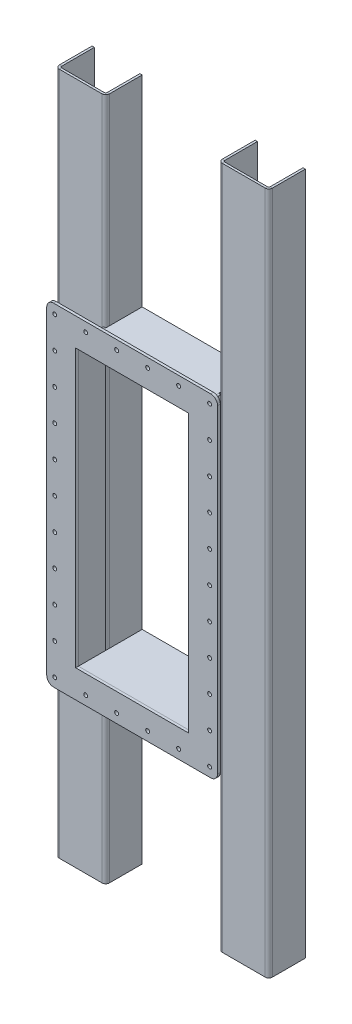
from build123d import *

# Parameters (mm, degrees)
SKETCH1_R             = 4.25
SKETCH1_W             = 248
SKETCH1_H             = 608
BOSS_EXTRUDE1_DEPTH   = 6
SKETCH2_W             = 60
SKETCH2_H             = 608
BOSS_EXTRUDE2_DEPTH   = 5
MOVE_FACE1_BY         = 5
MOVE_FACE1_2_BY       = 5
SKETCH3_W             = 248
SKETCH3_H             = 5
BOSS_EXTRUDE3_DEPTH   = 140
BOSS_EXTRUDE3_2_DEPTH = 140
BASE_FLANGE1_DEPTH    = 750


# Sheet-metal steps are written as plain solids
with BuildPart() as part:
    # Sketch1 → Boss-Extrude1 (new body)
    with BuildSketch(Plane.XY):
        with BuildLine():
            Line((-187.5, 350), (-187.5, -350))
            ThreePointArc((-187.5, -350), (-183.106601718, -360.606601718), (-172.5, -365))
            Line((-172.5, -365), (172.5, -365))
            ThreePointArc((172.5, -365), (183.106601718, -360.606601718), (187.5, -350))
            Line((187.5, -350), (187.5, 350))
            ThreePointArc((187.5, 350), (183.106601718, 360.606601718), (172.5, 365))
            Line((172.5, 365), (-172.5, 365))
            ThreePointArc((-172.5, 365), (-183.106601718, 360.606601718), (-187.5, 350))
        make_face()
        with Locations((170, 345)):
            Circle(SKETCH1_R, mode=Mode.SUBTRACT)
        with Locations((102, 345)):
            Circle(SKETCH1_R, mode=Mode.SUBTRACT)
        with Locations((34, 345)):
            Circle(SKETCH1_R, mode=Mode.SUBTRACT)
        with Locations((-34, 345)):
            Circle(SKETCH1_R, mode=Mode.SUBTRACT)
        with Locations((-102, 345)):
            Circle(SKETCH1_R, mode=Mode.SUBTRACT)
        with Locations((-170, 345)):
            Circle(SKETCH1_R, mode=Mode.SUBTRACT)
        with Locations((170, 276)):
            Circle(SKETCH1_R, mode=Mode.SUBTRACT)
        with Locations((170, 207)):
            Circle(SKETCH1_R, mode=Mode.SUBTRACT)
        with Locations((170, 138)):
            Circle(SKETCH1_R, mode=Mode.SUBTRACT)
        with Locations((170, 69)):
            Circle(SKETCH1_R, mode=Mode.SUBTRACT)
        with Locations((170, 0)):
            Circle(SKETCH1_R, mode=Mode.SUBTRACT)
        with Locations((170, -69)):
            Circle(SKETCH1_R, mode=Mode.SUBTRACT)
        with Locations((170, -138)):
            Circle(SKETCH1_R, mode=Mode.SUBTRACT)
        with Locations((170, -207)):
            Circle(SKETCH1_R, mode=Mode.SUBTRACT)
        with Locations((170, -276)):
            Circle(SKETCH1_R, mode=Mode.SUBTRACT)
        with Locations((170, -345)):
            Circle(SKETCH1_R, mode=Mode.SUBTRACT)
        with Locations((102, -345)):
            Circle(SKETCH1_R, mode=Mode.SUBTRACT)
        with Locations((34, -345)):
            Circle(SKETCH1_R, mode=Mode.SUBTRACT)
        with Locations((-34, -345)):
            Circle(SKETCH1_R, mode=Mode.SUBTRACT)
        with Locations((-102, -345)):
            Circle(SKETCH1_R, mode=Mode.SUBTRACT)
        with Locations((-170, -345)):
            Circle(SKETCH1_R, mode=Mode.SUBTRACT)
        with Locations((-170, -276)):
            Circle(SKETCH1_R, mode=Mode.SUBTRACT)
        with Locations((-170, -207)):
            Circle(SKETCH1_R, mode=Mode.SUBTRACT)
        with Locations((-170, -138)):
            Circle(SKETCH1_R, mode=Mode.SUBTRACT)
        with Locations((-170, -69)):
            Circle(SKETCH1_R, mode=Mode.SUBTRACT)
        with Locations((-170, 0)):
            Circle(SKETCH1_R, mode=Mode.SUBTRACT)
        with Locations((-170, 69)):
            Circle(SKETCH1_R, mode=Mode.SUBTRACT)
        with Locations((-170, 138)):
            Circle(SKETCH1_R, mode=Mode.SUBTRACT)
        with Locations((-170, 207)):
            Circle(SKETCH1_R, mode=Mode.SUBTRACT)
        with Locations((-170, 276)):
            Circle(SKETCH1_R, mode=Mode.SUBTRACT)
        Rectangle(SKETCH1_W, SKETCH1_H, mode=Mode.SUBTRACT)
    extrude(amount=-BOSS_EXTRUDE1_DEPTH)


with BuildPart() as body_2:
    # Sketch2 → Boss-Extrude2 (new body)
    with BuildSketch(Plane(origin=(-124, 0, 0), x_dir=(0, 0, -1), z_dir=(1, 0, 0))):
        with Locations((36, 0)):
            Rectangle(SKETCH2_W, SKETCH2_H)
    extrude(amount=-BOSS_EXTRUDE2_DEPTH)

    # Move Face1: a face moved outward by 5.0
    extrude(body_2.faces().sort_by_distance((-126.5, 304, -36))[0], amount=MOVE_FACE1_BY, dir=(0, 1, 0))

    # Move Face1 2: a face moved outward by 5.0
    extrude(body_2.faces().sort_by_distance((-126.5, -304, -36))[0], amount=MOVE_FACE1_2_BY, dir=(0, -1, 0))


with BuildPart() as body_3:
    # Mirror1: mirrored copy
    add(body_2.part.mirror(Plane(origin=(0, 0, 0), x_dir=(0, 0, 1), z_dir=(1, 0, 0))))


with BuildPart() as body_4:
    # Sketch3 → Boss-Extrude3 (new body)
    with BuildSketch(Plane(origin=(0, 0, -6), x_dir=(-1, 0, 0), z_dir=(0, 0, -1))):
        with Locations((0, 306.5)):
            Rectangle(SKETCH3_W, SKETCH3_H)
    extrude(amount=BOSS_EXTRUDE3_DEPTH)


with BuildPart() as body_5:
    # Sketch3 → Boss-Extrude3 2 (new body)
    with BuildSketch(Plane(origin=(0, 0, -6), x_dir=(-1, 0, 0), z_dir=(0, 0, -1))):
        with Locations((0, -306.5)):
            Rectangle(SKETCH3_W, SKETCH3_H)
    extrude(amount=BOSS_EXTRUDE3_2_DEPTH)


with BuildPart() as body_6:
    # Sketch8 → Base-Flange1 (new, symmetric)
    with BuildSketch(Plane(origin=(0, 0, 0), x_dir=(1, 0, 0), z_dir=(0, 1, 0))):
        with BuildLine():
            Line((124, 146), (124, 74))
            ThreePointArc((124, 74), (126.343145751, 68.343145751), (132, 66))
            Line((132, 66), (226, 66))
            ThreePointArc((226, 66), (231.656854249, 68.343145751), (234, 74))
            Line((234, 74), (234, 146))
            Line((234, 146), (229, 146))
            Line((229, 146), (229, 74))
            ThreePointArc((229, 74), (228.121320344, 71.878679656), (226, 71))
            Line((226, 71), (132, 71))
            ThreePointArc((132, 71), (129.878679656, 71.878679656), (129, 74))
            Line((129, 74), (129, 146))
            Line((129, 146), (124, 146))
        make_face()
    extrude(amount=BASE_FLANGE1_DEPTH, both=True)


with BuildPart() as body_7:
    # Mirror2: mirrored copy
    add(body_6.part.mirror(Plane(origin=(0, 0, 0), x_dir=(0, 0, 1), z_dir=(1, 0, 0))))


solid = Compound([part.part, body_2.part, body_3.part, body_4.part, body_5.part, body_6.part, body_7.part])
